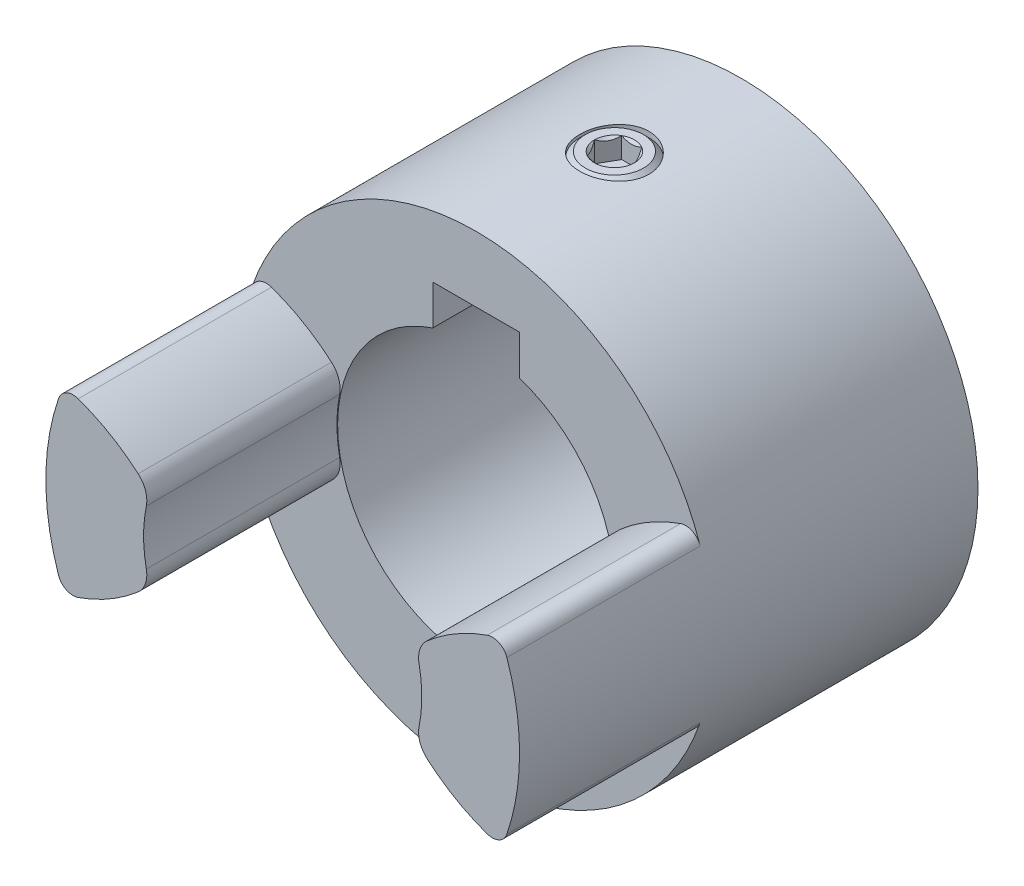
from build123d import *
from OCP.BRepFilletAPI import BRepFilletAPI_MakeChamfer

# Parameters (mm, degrees)
BOSS_EXTRUDE1_START     = -5.953125
SKETCH1_R               = 13.6921875
BOSS_EXTRUDE1_DEPTH     = 15.875
BOSS_EXTRUDE5_START     = 11.176
BOSS_EXTRUDE5_DEPTH     = 11.176
MOVE_START              = -5.953125
MOVE_FACE1_DEPTH        = 11.176
MOVE_FACE1_2_DEPTH      = 11.176
CIRPATTERN3_START       = -5.953125
CIRPATTERN3_DEPTH       = 11.176
CUT_EXTRUDE5_DEPTH      = 30.179085628
CUT_EXTRUDE5_DEPTH_BACK = 30.179085628
SKETCH15_R              = 8
CHAMFER1_SIZE           = 0.5476875
CHAMFER1_SIZE2          = 0.81198011
CUT_EXTRUDE1_DEPTH      = 30.179085628
CUT_EXTRUDE1_DEPTH_BACK = 30.179085628
SKETCH5_R               = 2
CUT_EXTRUDE2_DEPTH      = 30.179085628
SKETCH6_R               = 2
BOSS_EXTRUDE3_DEPTH     = 4
CUT_EXTRUDE3_DEPTH      = 1.2
CHAMFER3_SIZE           = 0.32
CHAMFER4_SIZE           = 0.68


# Read off the part's stored shape, not the designer's step: Move Face1, CirPattern3
with BuildPart() as part:
    # Sketch1 → Boss-Extrude1 (new body)
    with BuildSketch(Plane.XY.offset(BOSS_EXTRUDE1_START)):
        Circle(SKETCH1_R)
    extrude(amount=-BOSS_EXTRUDE1_DEPTH)

    # Sketch11 → Boss-Extrude5 (add)
    with BuildSketch(Plane.XY.offset(-5.953125).offset(BOSS_EXTRUDE5_START)):
        with BuildLine():
            ThreePointArc((-1.582501, -7.883505579), (-0.004369034, -8.040686324), (1.573762932, -7.883505579))
            ThreePointArc((1.573762932, -7.883505579), (2.326569083, -7.932638836), (2.952339417, -8.353996958))
            ThreePointArc((2.952339417, -8.353996958), (4.124174772, -9.993538922), (4.969226713, -11.823069782))
            ThreePointArc((4.969226713, -11.823069782), (4.930575443, -12.50660364), (4.417578974, -12.959976641))
            ThreePointArc((4.417578974, -12.959976641), (-0.006979455, -13.692185721), (-4.430789112, -12.955466274))
            ThreePointArc((-4.430789112, -12.955466274), (-4.941191352, -12.503649266), (-4.979409431, -11.823069782))
            ThreePointArc((-4.979409431, -11.823069782), (-4.13390788, -9.993483356), (-2.961583815, -8.353996958))
            ThreePointArc((-2.961583815, -8.353996958), (-2.335546152, -7.932611995), (-1.582501, -7.883505579))
        make_face()
    extrude(amount=-BOSS_EXTRUDE5_DEPTH)

    # Move Face1 outline → Move Face1 (cut)
    with BuildSketch(Plane.XY.offset(MOVE_START)):
        with BuildLine():
            ThreePointArc((-4.430789112, -12.955466274), (-0.006979455, -13.692185721), (4.417578974, -12.959976641))
            ThreePointArc((4.417578974, -12.959976641), (4.930575443, -12.50660364), (4.969226713, -11.823069782))
            ThreePointArc((4.969226713, -11.823069782), (4.124174772, -9.993538922), (2.952339417, -8.353996958))
            ThreePointArc((2.952339417, -8.353996958), (2.326569083, -7.932638836), (1.573762932, -7.883505579))
            ThreePointArc((1.573762932, -7.883505579), (-0.004369034, -8.040686324), (-1.582501, -7.883505579))
            ThreePointArc((-1.582501, -7.883505579), (-2.335546152, -7.932611995), (-2.961583815, -8.353996958))
            ThreePointArc((-2.961583815, -8.353996958), (-4.13390788, -9.993483356), (-4.979409431, -11.823069782))
            ThreePointArc((-4.979409431, -11.823069782), (-4.941191352, -12.503649266), (-4.430789112, -12.955466274))
        make_face()
    extrude(amount=MOVE_FACE1_DEPTH, mode=Mode.SUBTRACT)

    # Move Face1 2 outline → Move Face1 2 (add)
    with BuildSketch(Plane.XY.offset(MOVE_START)):
        with BuildLine():
            ThreePointArc((7.883505579, -1.582501), (7.932611995, -2.335546152), (8.353996958, -2.961583815))
            ThreePointArc((8.353996958, -2.961583815), (9.993483356, -4.13390788), (11.823069782, -4.979409431))
            ThreePointArc((11.823069782, -4.979409431), (12.503649266, -4.941191352), (12.955466274, -4.430789112))
            ThreePointArc((12.955466274, -4.430789112), (13.692185721, -0.006979455), (12.959976641, 4.417578974))
            ThreePointArc((12.959976641, 4.417578974), (12.50660364, 4.930575443), (11.823069782, 4.969226713))
            ThreePointArc((11.823069782, 4.969226713), (9.993538922, 4.124174772), (8.353996958, 2.952339417))
            ThreePointArc((8.353996958, 2.952339417), (7.932638836, 2.326569083), (7.883505579, 1.573762932))
            ThreePointArc((7.883505579, 1.573762932), (8.040686324, -0.004369034), (7.883505579, -1.582501))
        make_face()
    extrude(amount=MOVE_FACE1_2_DEPTH)

    # CirPattern3 outline → CirPattern3 (add)
    with BuildSketch(Plane.XY.offset(CIRPATTERN3_START)):
        with BuildLine():
            ThreePointArc((-7.883505579, 1.582501), (-7.932611995, 2.335546152), (-8.353996958, 2.961583815))
            ThreePointArc((-8.353996958, 2.961583815), (-9.993483356, 4.13390788), (-11.823069782, 4.979409431))
            ThreePointArc((-11.823069782, 4.979409431), (-12.503649266, 4.941191352), (-12.955466274, 4.430789112))
            ThreePointArc((-12.955466274, 4.430789112), (-13.692185721, 0.006979455), (-12.959976641, -4.417578974))
            ThreePointArc((-12.959976641, -4.417578974), (-12.50660364, -4.930575443), (-11.823069782, -4.969226713))
            ThreePointArc((-11.823069782, -4.969226713), (-9.993538922, -4.124174772), (-8.353996958, -2.952339417))
            ThreePointArc((-8.353996958, -2.952339417), (-7.932638836, -2.326569083), (-7.883505579, -1.573762932))
            ThreePointArc((-7.883505579, -1.573762932), (-8.040686324, 0.004369034), (-7.883505579, 1.582501))
        make_face()
    extrude(amount=CIRPATTERN3_DEPTH)

    # Sketch15 → Cut-Extrude5 (cut, two sides: drawn at the far end of the back side and taken through both)
    with BuildSketch(Plane.XY.offset(-CUT_EXTRUDE5_DEPTH_BACK)):
        Circle(SKETCH15_R)
    extrude(amount=CUT_EXTRUDE5_DEPTH + CUT_EXTRUDE5_DEPTH_BACK, mode=Mode.SUBTRACT)

    # Chamfer1: one chamfer whose edges measure the first distance from different faces: ONE call of the kernel's chamfer builder (chamfer() names one face for all edges)
    chamfer1_edges_1 = [part.edges().sort_by_distance(p)[0] for p in [
        (-13.6921875, 0, -21.828125),
    ]]
    chamfer1_side_1 = [part.faces().sort_by_distance(p)[0] for p in [
        (-13.6921875, 0, -13.890625),
    ]]
    chamfer1_edges_2 = [part.edges().sort_by_distance(p)[0] for p in [
        (-8, 0, -21.828125),
    ]]
    chamfer1_side_2 = [part.faces().sort_by_distance(p)[0] for p in [
        (-8, 0, -13.890625),
    ]]
    chamfer1 = BRepFilletAPI_MakeChamfer(part.part.solid().wrapped)
    for e in chamfer1_edges_1:
        chamfer1.Add(CHAMFER1_SIZE, CHAMFER1_SIZE2, e.wrapped, chamfer1_side_1[0].wrapped)  # the first distance lies on this face
    for e in chamfer1_edges_2:
        chamfer1.Add(CHAMFER1_SIZE, CHAMFER1_SIZE2, e.wrapped, chamfer1_side_2[0].wrapped)  # the first distance lies on this face
    add(Compound.cast(chamfer1.Shape()), mode=Mode.REPLACE)

    # Sketch4 → Cut-Extrude1 (cut, two sides: drawn at the far end of the back side and taken through both)
    with BuildSketch(Plane.XY.offset(-CUT_EXTRUDE1_DEPTH_BACK)):
        with BuildLine():
            Line((-2.5, 9.899342077), (2.5, 9.899342077))
            Line((2.5, 9.899342077), (2.5, 7.599342077))
            ThreePointArc((2.5, 7.599342077), (0, 8), (-2.5, 7.599342077))
            Line((-2.5, 7.599342077), (-2.5, 9.899342077))
        make_face()
    extrude(amount=CUT_EXTRUDE1_DEPTH + CUT_EXTRUDE1_DEPTH_BACK, mode=Mode.SUBTRACT)

    # Sketch5 → Cut-Extrude2 (cut, through all)
    with BuildSketch(Plane(origin=(0, 0, 0), x_dir=(1, 0, 0), z_dir=(0, 1, 0))):
        with Locations(Location((0, 13.954125, 0), (0, 0, 90))):
            Circle(SKETCH5_R)
    extrude(amount=CUT_EXTRUDE2_DEPTH, mode=Mode.SUBTRACT)


with BuildPart() as body_2:
    # Sketch6 → Boss-Extrude3 (new body)
    with BuildSketch(Plane(origin=(0, 13.6921875, 0), x_dir=(-1, 0, 0), z_dir=(0, 1, 0))):
        with Locations(Location((0, -13.954125, 0), (0, 0, 90))):
            Circle(SKETCH6_R)
    extrude(amount=-BOSS_EXTRUDE3_DEPTH)

    # Sketch8 → Cut-Extrude3 (cut)
    with BuildSketch(Plane(origin=(0, 13.6921875, 0), x_dir=(1, 0, 0), z_dir=(0, 1, 0))):
        Polygon((0.577350269, 12.954125), (1.154700538, 13.954125), (0.577350269, 14.954125), (-0.577350269, 14.954125), (-1.154700538, 13.954125), (-0.577350269, 12.954125), align=None)
    extrude(amount=-CUT_EXTRUDE3_DEPTH, mode=Mode.SUBTRACT)

    # Cut-Extrude4 cone 1 section (through the dimple's axis) → Cut-Extrude4 (revolve, cut)
    with BuildSketch(Plane(origin=(0, 13.6921875, -13.954125), x_dir=(0, 0, 1), z_dir=(1, 0, 0))):
        Polygon((0, 0), (1.154700538, 0), (0, 1.154700538), align=None)
    revolve(axis=Axis((0, 13.6921875, -13.954125), (0, -1, 0)), mode=Mode.SUBTRACT)

    # Chamfer3
    chamfer3_edges = [body_2.edges().sort_by_distance(p)[0] for p in [
        (0, 13.6921875, -15.954125),
    ]]
    chamfer(chamfer3_edges, length=CHAMFER3_SIZE)

    # Chamfer4
    chamfer4_edges = [body_2.edges().sort_by_distance(p)[0] for p in [
        (0, 9.6921875, -15.954125),
    ]]
    chamfer(chamfer4_edges, length=CHAMFER4_SIZE)


solid = Compound([part.part, body_2.part])
